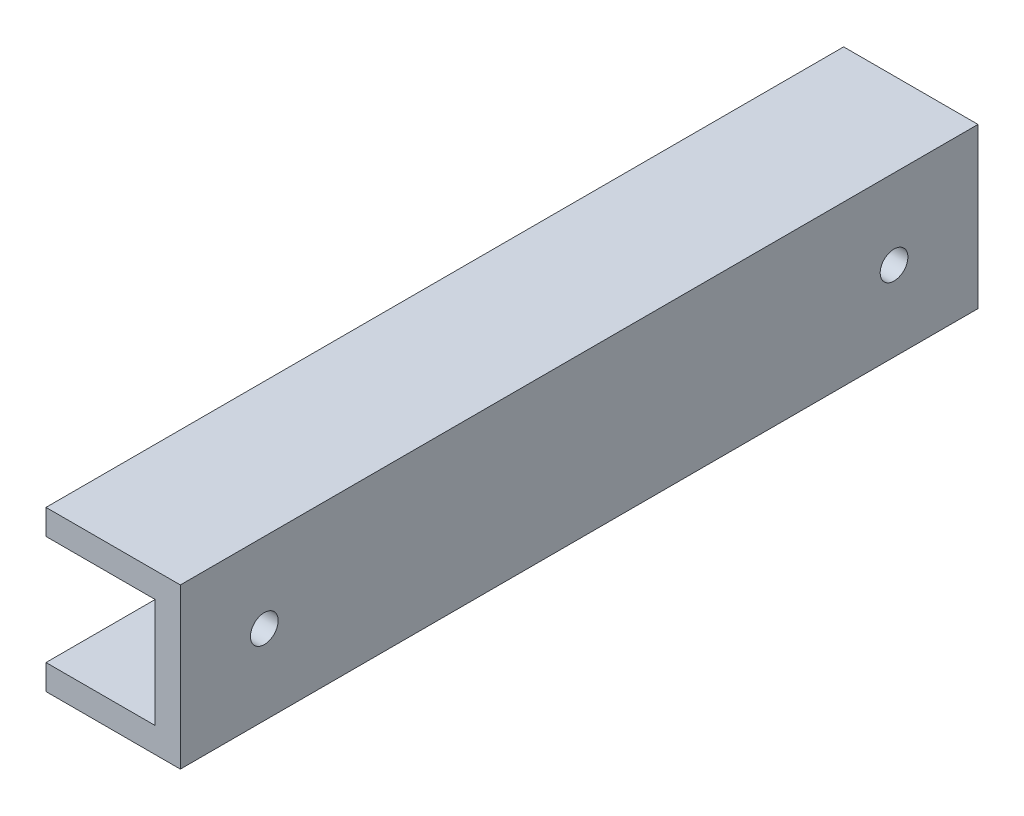
from build123d import *

# Parameters (mm, degrees)
SKETCH_1_W          = 19
SKETCH_1_H          = 19
SKETCH_1_W_2        = 13
SKETCH_1_H_2        = 13
EXTRUDE_1_DEPTH     = 95
SKETCH_2_R          = 1.65
CUT_EXTRUDE_1_DEPTH = 30
SKETCH_3_W          = 116.915177823
SKETCH_3_H          = 46.219516436
CUT_EXTRUDE_2_DEPTH = 3
SKETCH_4_W          = 5
SKETCH_4_H          = 13
EXTRUDE_1_2_DEPTH   = 10
SKETCH_5_W          = 39
SKETCH_5_H          = 5
EXTRUDE_2_DEPTH     = 10
SKETCH_6_W          = 49
SKETCH_6_H          = 13
EXTRUDE_3_DEPTH     = 10
SKETCH_8_W          = 49
SKETCH_8_H          = 5
CUT_EXTRUDE_3_DEPTH = 3
CHAMFER_1_SIZE      = 3
CHAMFER_2_SIZE      = 4


with BuildPart() as part:
    # 草图1 → Extrude 1 (new body)
    with BuildSketch(Plane.XY):
        with Locations((6.5, 6.5)):
            Rectangle(SKETCH_1_W, SKETCH_1_H)
        with Locations((6.5, 6.5)):
            Rectangle(SKETCH_1_W_2, SKETCH_1_H_2, mode=Mode.SUBTRACT)
    extrude(amount=EXTRUDE_1_DEPTH)

    # 草图2 → 切除-拉伸1 (cut)
    with BuildSketch(Plane.ZY.offset(3)):
        with Locations((10, 6.5)):
            Circle(SKETCH_2_R)
        with Locations((85, 6.5)):
            Circle(SKETCH_2_R)
    extrude(amount=-CUT_EXTRUDE_1_DEPTH, mode=Mode.SUBTRACT)

    # 草图3 → 切除-拉伸2 (cut)
    with BuildSketch(Plane.ZY.offset(3)):
        with Locations((53.162237228, 0.202739406)):
            Rectangle(SKETCH_3_W, SKETCH_3_H)
    extrude(amount=-CUT_EXTRUDE_2_DEPTH, mode=Mode.SUBTRACT)

    # 草图4 → Extrude 1 2 (add)
    with BuildSketch(Plane.ZY.offset(-13)):
        with Locations((25.5, 6.5)):
            Rectangle(SKETCH_4_W, SKETCH_4_H)
        with Locations((69.5, 6.5)):
            Rectangle(SKETCH_4_W, SKETCH_4_H)
    extrude(amount=EXTRUDE_1_2_DEPTH)

    # 草图5 → 凸台-拉伸2 (add)
    with BuildSketch(Plane.ZY.offset(-13)):
        with Locations((47.5, 6.5)):
            Rectangle(SKETCH_5_W, SKETCH_5_H)
    extrude(amount=EXTRUDE_2_DEPTH)

    # 草图6 → 凸台-拉伸3 (add)
    with BuildSketch(Plane.ZY.offset(-13)):
        with Locations((47.5, 6.5)):
            Rectangle(SKETCH_6_W, SKETCH_6_H)
    extrude(amount=EXTRUDE_3_DEPTH)

    # 草图8 → 切除-拉伸3 (cut)
    with BuildSketch(Plane.ZY.offset(-3)):
        with Locations((47.5, 6.5)):
            Rectangle(SKETCH_8_W, SKETCH_8_H)
    extrude(amount=-CUT_EXTRUDE_3_DEPTH, mode=Mode.SUBTRACT)

    # 倒角1
    chamfer_1_edges = [part.edges().sort_by_distance(p)[0] for p in [
        (6, 6.5, 23),
        (6, 6.5, 72),
    ]]
    chamfer(chamfer_1_edges, length=CHAMFER_1_SIZE)

    # 倒角2
    chamfer_2_edges = [part.edges().sort_by_distance(p)[0] for p in [
        (13, 6.5, 23),
        (13, 6.5, 72),
    ]]
    chamfer(chamfer_2_edges, length=CHAMFER_2_SIZE - 0.0001)  # a hair under: the kernel refuses the full size


solid = part.part
